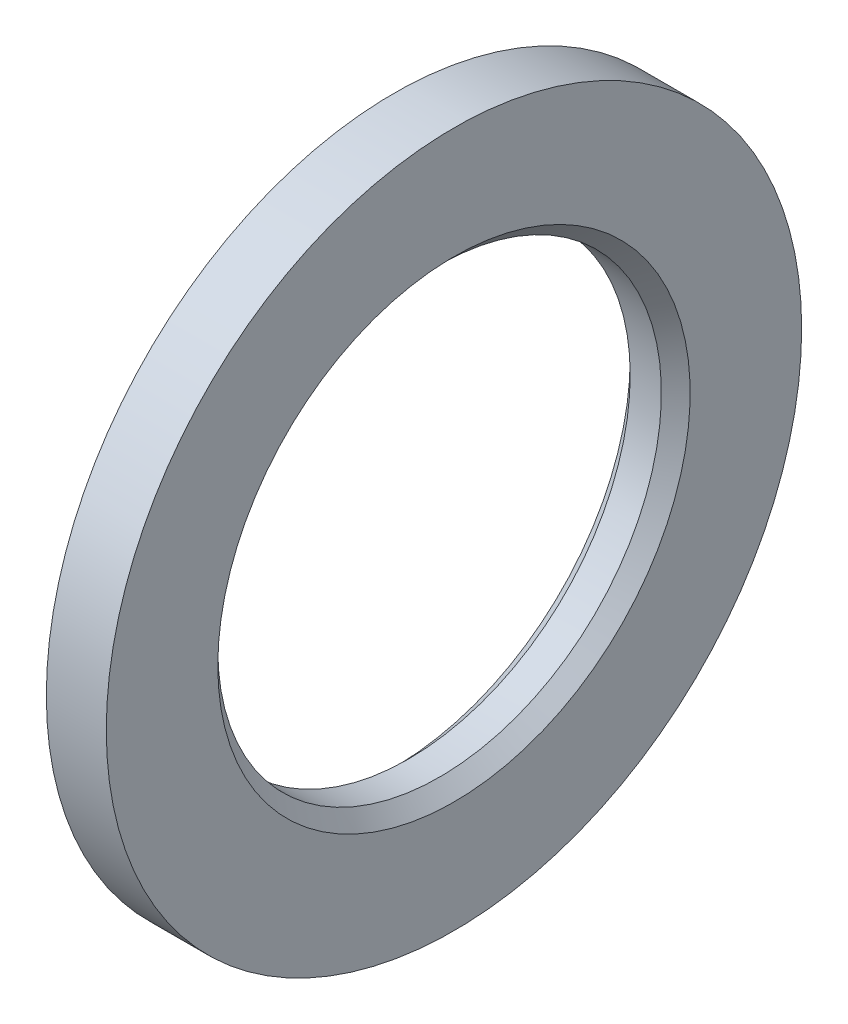
from build123d import *

# Parameters (mm, degrees)
SKETCH1_W         = 5
SKETCH1_H         = 10.5
IDCHAMFER_SIZE    = 1.2
IDCHAMFERFAR_SIZE = 1.2


with BuildPart() as part:
    # Sketch1 → Base-Revolve (revolve)
    with BuildSketch(Plane.XY):
        with Locations((-2.5, 23.75)):
            Rectangle(SKETCH1_W, SKETCH1_H)
    revolve(axis=Axis((-34.925, 0, 0), (1, 0, 0)))

    # IDChamfer
    idchamfer_edges = [part.edges().sort_by_distance(p)[0] for p in [
        (0, -18.5, 0),
    ]]
    chamfer(idchamfer_edges, length=IDCHAMFER_SIZE)

    # IDChamferFar
    idchamferfar_edges = [part.edges().sort_by_distance(p)[0] for p in [
        (-5, -18.5, 0),
    ]]
    chamfer(idchamferfar_edges, length=IDCHAMFERFAR_SIZE)


solid = part.part
